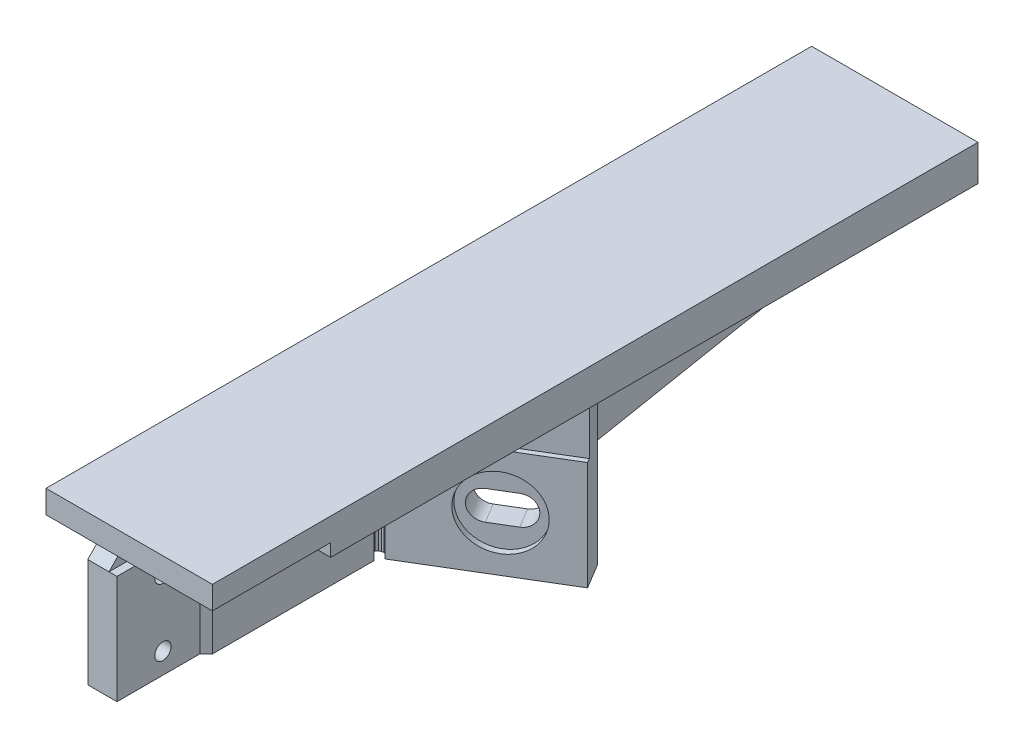
from build123d import *

# Parameters (mm, degrees)
LEG_AND_PAD_DEPTH                     = 13
SCREW_HEAD_RELIEF_SKETCH_W            = 14
SCREW_HEAD_RELIEF_SKETCH_H            = 6
SCREW_HEAD_RELIEF_DEPTH               = 2.35
M6_SLOT_MIDDLE_DEPTH                  = 3.5
SCREW_HOLES_SKETCH_R                  = 1.95
SCREW_HOLES_DEPTH                     = 4.5
FOOT_LEG_DEPTH                        = 6.1
SOLE_UNDER_THE_HOUSING_SKETCH_W       = 39.841788068
SOLE_UNDER_THE_HOUSING_SKETCH_H       = 155.03
SOLE_UNDER_THE_HOUSING_DEPTH          = 4.285
SOLE_UNDER_THE_BLOCK_SKETCH_W         = 39.841788068
SOLE_UNDER_THE_BLOCK_SKETCH_H         = 28.84
SOLE_UNDER_THE_BLOCK_DEPTH            = 2.75
SEAT_GUSSET_DEPTH                     = 2.55
TAIL_RIB_DEPTH                        = 3
SIDE_BRACE_DEPTH                      = 3.71
SCREW_HEAD_RELIEF_TO_THE_END_SKETCH_W = 14
SCREW_HEAD_RELIEF_TO_THE_END_SKETCH_H = 16
SCREW_HEAD_RELIEF_TO_THE_END_DEPTH    = 2.35


with BuildPart() as part:
    # leg and pad sketch → leg and pad (new, symmetric)
    with BuildSketch(Plane(origin=(0, -20.7, 0), x_dir=(1, 0, 0), z_dir=(0, 1, 0))):
        Polygon((0.551289683, 30.332713936), (0.367250577, 30.819395741), (0.028023026, 31.213926146), (-0.425575667, 31.468833575), (-0.938966578, 31.553446481), (-1.450376329, 31.457583879), (-1.898269923, 31.192780366), (-2.228754897, 30.790898227), (-2.402065893, 30.30029363), (-2.397349395, 29.779998208), (-2.215172912, 29.292616119), (-1.877456693, 28.896791249), (-1.424836191, 28.640150931), (-0.91177263, 28.55357522), (-0.4, 28.647481273), (-0.4, -9.98), (-1.92, -11.5), (-1.92, -31.37), (-8.92, -31.37), (-8.92, 32.792642706), (27.204821487, 54.594667874), (30.821788068, 48.601542416), align=None)
    extrude(amount=LEG_AND_PAD_DEPTH, both=True)

    # screw head relief sketch → screw head relief (cut, symmetric)
    with BuildSketch(Plane(origin=(-1.35, 0, 0), x_dir=(0, 0, -1), z_dir=(1, 0, 0))):
        with Locations((16.4, -9.7)):
            Rectangle(SCREW_HEAD_RELIEF_SKETCH_W, SCREW_HEAD_RELIEF_SKETCH_H)
    extrude(amount=SCREW_HEAD_RELIEF_DEPTH, both=True, mode=Mode.SUBTRACT)

    # insert flange relief sketch → insert flange relief (revolve, cut)
    with BuildSketch(Plane(origin=(0, -20.7, 0), x_dir=(1, 0, 0), z_dir=(0, 1, 0))):
        Polygon((18.324853729, 39.891397061), (17.03307995, 42.03179901), (9.755713323, 37.639768162), (11.047487102, 35.499366213), align=None)
    revolve(axis=Axis((18.324853729, -20.7, -39.891397061), (-0.5167095115681243, 0, -0.8561607796757748)), mode=Mode.SUBTRACT)

    # M6 slot end 1 sketch → M6 slot end 1 (revolve, cut)
    with BuildSketch(Plane(origin=(0, -20.7, 0), x_dir=(1, 0, 0), z_dir=(0, 1, 0))):
        Polygon((20.893336068, 41.441525596), (16.242950464, 49.146972613), (13.246387735, 47.338489322), (17.896773339, 39.633042305), align=None)
    revolve(axis=Axis((20.893336068, -20.7, -41.441525596), (-0.5167095115681233, 0, -0.8561607796757753)), mode=Mode.SUBTRACT)

    # M6 slot end 2 sketch → M6 slot end 2 (revolve, cut)
    with BuildSketch(Plane(origin=(0, -20.7, 0), x_dir=(1, 0, 0), z_dir=(0, 1, 0))):
        Polygon((15.75637139, 38.341268526), (11.105985786, 46.046715543), (8.109423057, 44.238232253), (12.759808661, 36.532785236), align=None)
    revolve(axis=Axis((15.75637139, -20.7, -38.341268526), (-0.5167095115681234, 0, -0.8561607796757752)), mode=Mode.SUBTRACT)

    # M6 slot middle sketch → M6 slot middle (cut, symmetric)
    with BuildSketch(Plane(origin=(0, -20.7, 0), x_dir=(1, 0, 0), z_dir=(0, 1, 0))):
        Polygon((15.75637139, 38.341268526), (20.893336068, 41.441525596), (16.242950464, 49.146972613), (11.105985786, 46.046715543), align=None)
    extrude(amount=M6_SLOT_MIDDLE_DEPTH, both=True, mode=Mode.SUBTRACT)

    # screw holes sketch → screw holes (cut, symmetric)
    with BuildSketch(Plane(origin=(-5.42, 0, 0), x_dir=(0, 0, -1), z_dir=(1, 0, 0))):
        with Locations((-20.375, -28.7)):
            Circle(SCREW_HOLES_SKETCH_R)
        with Locations((-20.375, -12.7)):
            Circle(SCREW_HOLES_SKETCH_R)
    extrude(amount=SCREW_HOLES_DEPTH, both=True, mode=Mode.SUBTRACT)

    # foot leg sketch → foot leg (add, symmetric)
    with BuildSketch(Plane(origin=(0, -2.1, 0), x_dir=(1, 0, 0), z_dir=(0, 1, 0))):
        Polygon((-2.3, 30.013511625), (-2.3, -9.98), (-8.92, -9.98), (-8.92, 32.792642706), (27.204821487, 54.594667874), (30.201736654, 49.628935352), align=None)
    extrude(amount=FOOT_LEG_DEPTH, both=True)

    # sole under the housing sketch → sole under the housing (add, symmetric)
    with BuildSketch(Plane(origin=(0, 7.785, 0), x_dir=(1, 0, 0), z_dir=(0, 1, 0))):
        with Locations((11.000894034, 64.485)):
            Rectangle(SOLE_UNDER_THE_HOUSING_SKETCH_W, SOLE_UNDER_THE_HOUSING_SKETCH_H)
    extrude(amount=SOLE_UNDER_THE_HOUSING_DEPTH, both=True)

    # sole under the block sketch → sole under the block (add, symmetric)
    with BuildSketch(Plane(origin=(0, 9.32, 0), x_dir=(1, 0, 0), z_dir=(0, 1, 0))):
        with Locations((11.000894034, -26.95)):
            Rectangle(SOLE_UNDER_THE_BLOCK_SKETCH_W, SOLE_UNDER_THE_BLOCK_SKETCH_H)
    extrude(amount=SOLE_UNDER_THE_BLOCK_DEPTH, both=True)

    # seat gusset sketch → seat gusset (add, symmetric)
    with BuildSketch(Plane(origin=(-6.37, 0, 0), x_dir=(0, 0, -1), z_dir=(1, 0, 0))):
        Polygon((-9.48, -8.2), (-31.37, -8.2), (-31.37, -7.7), (-17.1, 7.07), (-9.48, 7.07), align=None)
    extrude(amount=SEAT_GUSSET_DEPTH, both=True)

    # tail rib sketch → tail rib (add, symmetric)
    with BuildSketch(Plane(origin=(19.921788068, 0, 0), x_dir=(0, 0, -1), z_dir=(1, 0, 0))):
        Polygon((53.1, 4), (53.1, -12.5), (57.1, -12.5), (140, 3.5), (140, 4), align=None)
    extrude(amount=TAIL_RIB_DEPTH, both=True)

    # side brace sketch → side brace (add, symmetric)
    with BuildSketch(Plane(origin=(-5.21, 0, 0), x_dir=(0, 0, -1), z_dir=(1, 0, 0))):
        Polygon((142, 4), (142, 0.5), (37.792642706, -33.7), (31.792642706, -33.7), (31.792642706, 4), align=None)
    extrude(amount=SIDE_BRACE_DEPTH, both=True)

    # screw head relief to the end sketch → screw head relief to the end (cut, symmetric)
    with BuildSketch(Plane(origin=(-1.35, 0, 0), x_dir=(0, 0, -1), z_dir=(1, 0, 0))):
        with Locations((16.4, -4.7)):
            Rectangle(SCREW_HEAD_RELIEF_TO_THE_END_SKETCH_W, SCREW_HEAD_RELIEF_TO_THE_END_SKETCH_H)
    extrude(amount=SCREW_HEAD_RELIEF_TO_THE_END_DEPTH, both=True, mode=Mode.SUBTRACT)


solid = part.part
